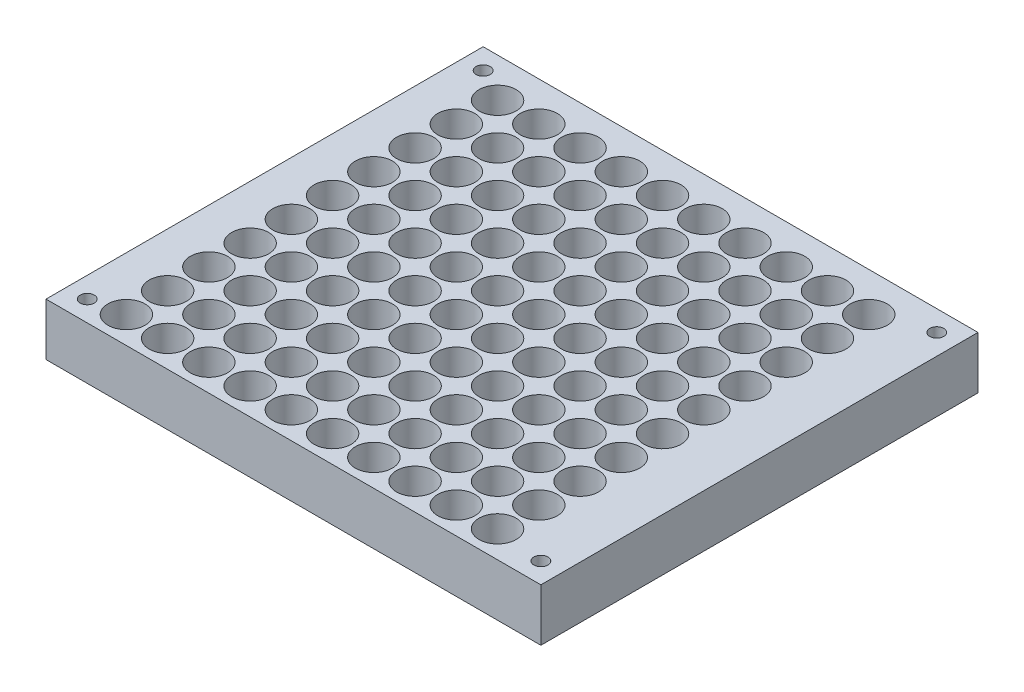
from build123d import *

# Parameters (mm, degrees)
SKETCH1_W           = 120
SKETCH1_H           = 106
SKETCH1_R           = 1.7
SKETCH1_R_2         = 4.5
BOSS_EXTRUDE1_DEPTH = 12.7


with BuildPart() as part:
    # Sketch1 → Boss-Extrude1 (new body)
    with BuildSketch(Plane(origin=(0, 0, 0), x_dir=(1, 0, 0), z_dir=(0, 1, 0))):
        with Locations((60, 53)):
            Rectangle(SKETCH1_W, SKETCH1_H)
        with Locations((5, 5)):
            Circle(SKETCH1_R, mode=Mode.SUBTRACT)
        with Locations((13, 6.5)):
            Circle(SKETCH1_R_2, mode=Mode.SUBTRACT)
        with Locations((23, 6.5)):
            Circle(SKETCH1_R_2, mode=Mode.SUBTRACT)
        with Locations((13, 16.5)):
            Circle(SKETCH1_R_2, mode=Mode.SUBTRACT)
        with Locations((13, 26.5)):
            Circle(SKETCH1_R_2, mode=Mode.SUBTRACT)
        with Locations((23, 16.5)):
            Circle(SKETCH1_R_2, mode=Mode.SUBTRACT)
        with Locations((23, 26.5)):
            Circle(SKETCH1_R_2, mode=Mode.SUBTRACT)
        with Locations((33, 6.5)):
            Circle(SKETCH1_R_2, mode=Mode.SUBTRACT)
        with Locations((43, 6.5)):
            Circle(SKETCH1_R_2, mode=Mode.SUBTRACT)
        with Locations((53, 6.5)):
            Circle(SKETCH1_R_2, mode=Mode.SUBTRACT)
        with Locations((33, 16.5)):
            Circle(SKETCH1_R_2, mode=Mode.SUBTRACT)
        with Locations((43, 16.5)):
            Circle(SKETCH1_R_2, mode=Mode.SUBTRACT)
        with Locations((33, 26.5)):
            Circle(SKETCH1_R_2, mode=Mode.SUBTRACT)
        with Locations((43, 26.5)):
            Circle(SKETCH1_R_2, mode=Mode.SUBTRACT)
        with Locations((53, 16.5)):
            Circle(SKETCH1_R_2, mode=Mode.SUBTRACT)
        with Locations((53, 26.5)):
            Circle(SKETCH1_R_2, mode=Mode.SUBTRACT)
        with Locations((13, 36.5)):
            Circle(SKETCH1_R_2, mode=Mode.SUBTRACT)
        with Locations((23, 36.5)):
            Circle(SKETCH1_R_2, mode=Mode.SUBTRACT)
        with Locations((13, 46.5)):
            Circle(SKETCH1_R_2, mode=Mode.SUBTRACT)
        with Locations((23, 46.5)):
            Circle(SKETCH1_R_2, mode=Mode.SUBTRACT)
        with Locations((33, 36.5)):
            Circle(SKETCH1_R_2, mode=Mode.SUBTRACT)
        with Locations((43, 36.5)):
            Circle(SKETCH1_R_2, mode=Mode.SUBTRACT)
        with Locations((53, 36.5)):
            Circle(SKETCH1_R_2, mode=Mode.SUBTRACT)
        with Locations((33, 46.5)):
            Circle(SKETCH1_R_2, mode=Mode.SUBTRACT)
        with Locations((43, 46.5)):
            Circle(SKETCH1_R_2, mode=Mode.SUBTRACT)
        with Locations((53, 46.5)):
            Circle(SKETCH1_R_2, mode=Mode.SUBTRACT)
        with Locations((63, 6.5)):
            Circle(SKETCH1_R_2, mode=Mode.SUBTRACT)
        with Locations((73, 6.5)):
            Circle(SKETCH1_R_2, mode=Mode.SUBTRACT)
        with Locations((83, 6.5)):
            Circle(SKETCH1_R_2, mode=Mode.SUBTRACT)
        with Locations((63, 16.5)):
            Circle(SKETCH1_R_2, mode=Mode.SUBTRACT)
        with Locations((73, 16.5)):
            Circle(SKETCH1_R_2, mode=Mode.SUBTRACT)
        with Locations((63, 26.5)):
            Circle(SKETCH1_R_2, mode=Mode.SUBTRACT)
        with Locations((73, 26.5)):
            Circle(SKETCH1_R_2, mode=Mode.SUBTRACT)
        with Locations((83, 16.5)):
            Circle(SKETCH1_R_2, mode=Mode.SUBTRACT)
        with Locations((83, 26.5)):
            Circle(SKETCH1_R_2, mode=Mode.SUBTRACT)
        with Locations((93, 6.5)):
            Circle(SKETCH1_R_2, mode=Mode.SUBTRACT)
        with Locations((103, 6.5)):
            Circle(SKETCH1_R_2, mode=Mode.SUBTRACT)
        with Locations((115, 5)):
            Circle(SKETCH1_R, mode=Mode.SUBTRACT)
        with Locations((93, 16.5)):
            Circle(SKETCH1_R_2, mode=Mode.SUBTRACT)
        with Locations((103, 16.5)):
            Circle(SKETCH1_R_2, mode=Mode.SUBTRACT)
        with Locations((93, 26.5)):
            Circle(SKETCH1_R_2, mode=Mode.SUBTRACT)
        with Locations((103, 26.5)):
            Circle(SKETCH1_R_2, mode=Mode.SUBTRACT)
        with Locations((63, 36.5)):
            Circle(SKETCH1_R_2, mode=Mode.SUBTRACT)
        with Locations((73, 36.5)):
            Circle(SKETCH1_R_2, mode=Mode.SUBTRACT)
        with Locations((83, 36.5)):
            Circle(SKETCH1_R_2, mode=Mode.SUBTRACT)
        with Locations((63, 46.5)):
            Circle(SKETCH1_R_2, mode=Mode.SUBTRACT)
        with Locations((73, 46.5)):
            Circle(SKETCH1_R_2, mode=Mode.SUBTRACT)
        with Locations((83, 46.5)):
            Circle(SKETCH1_R_2, mode=Mode.SUBTRACT)
        with Locations((93, 36.5)):
            Circle(SKETCH1_R_2, mode=Mode.SUBTRACT)
        with Locations((103, 36.5)):
            Circle(SKETCH1_R_2, mode=Mode.SUBTRACT)
        with Locations((93, 46.5)):
            Circle(SKETCH1_R_2, mode=Mode.SUBTRACT)
        with Locations((103, 46.5)):
            Circle(SKETCH1_R_2, mode=Mode.SUBTRACT)
        with Locations((13, 56.5)):
            Circle(SKETCH1_R_2, mode=Mode.SUBTRACT)
        with Locations((23, 56.5)):
            Circle(SKETCH1_R_2, mode=Mode.SUBTRACT)
        with Locations((13, 66.5)):
            Circle(SKETCH1_R_2, mode=Mode.SUBTRACT)
        with Locations((13, 76.5)):
            Circle(SKETCH1_R_2, mode=Mode.SUBTRACT)
        with Locations((23, 66.5)):
            Circle(SKETCH1_R_2, mode=Mode.SUBTRACT)
        with Locations((23, 76.5)):
            Circle(SKETCH1_R_2, mode=Mode.SUBTRACT)
        with Locations((33, 56.5)):
            Circle(SKETCH1_R_2, mode=Mode.SUBTRACT)
        with Locations((43, 56.5)):
            Circle(SKETCH1_R_2, mode=Mode.SUBTRACT)
        with Locations((53, 56.5)):
            Circle(SKETCH1_R_2, mode=Mode.SUBTRACT)
        with Locations((33, 66.5)):
            Circle(SKETCH1_R_2, mode=Mode.SUBTRACT)
        with Locations((43, 66.5)):
            Circle(SKETCH1_R_2, mode=Mode.SUBTRACT)
        with Locations((33, 76.5)):
            Circle(SKETCH1_R_2, mode=Mode.SUBTRACT)
        with Locations((43, 76.5)):
            Circle(SKETCH1_R_2, mode=Mode.SUBTRACT)
        with Locations((53, 66.5)):
            Circle(SKETCH1_R_2, mode=Mode.SUBTRACT)
        with Locations((53, 76.5)):
            Circle(SKETCH1_R_2, mode=Mode.SUBTRACT)
        with Locations((13, 86.5)):
            Circle(SKETCH1_R_2, mode=Mode.SUBTRACT)
        with Locations((23, 86.5)):
            Circle(SKETCH1_R_2, mode=Mode.SUBTRACT)
        with Locations((13, 96.5)):
            Circle(SKETCH1_R_2, mode=Mode.SUBTRACT)
        with Locations((5, 101)):
            Circle(SKETCH1_R, mode=Mode.SUBTRACT)
        with Locations((23, 96.5)):
            Circle(SKETCH1_R_2, mode=Mode.SUBTRACT)
        with Locations((33, 86.5)):
            Circle(SKETCH1_R_2, mode=Mode.SUBTRACT)
        with Locations((43, 86.5)):
            Circle(SKETCH1_R_2, mode=Mode.SUBTRACT)
        with Locations((53, 86.5)):
            Circle(SKETCH1_R_2, mode=Mode.SUBTRACT)
        with Locations((33, 96.5)):
            Circle(SKETCH1_R_2, mode=Mode.SUBTRACT)
        with Locations((43, 96.5)):
            Circle(SKETCH1_R_2, mode=Mode.SUBTRACT)
        with Locations((53, 96.5)):
            Circle(SKETCH1_R_2, mode=Mode.SUBTRACT)
        with Locations((63, 56.5)):
            Circle(SKETCH1_R_2, mode=Mode.SUBTRACT)
        with Locations((73, 56.5)):
            Circle(SKETCH1_R_2, mode=Mode.SUBTRACT)
        with Locations((83, 56.5)):
            Circle(SKETCH1_R_2, mode=Mode.SUBTRACT)
        with Locations((63, 66.5)):
            Circle(SKETCH1_R_2, mode=Mode.SUBTRACT)
        with Locations((73, 66.5)):
            Circle(SKETCH1_R_2, mode=Mode.SUBTRACT)
        with Locations((63, 76.5)):
            Circle(SKETCH1_R_2, mode=Mode.SUBTRACT)
        with Locations((73, 76.5)):
            Circle(SKETCH1_R_2, mode=Mode.SUBTRACT)
        with Locations((83, 66.5)):
            Circle(SKETCH1_R_2, mode=Mode.SUBTRACT)
        with Locations((83, 76.5)):
            Circle(SKETCH1_R_2, mode=Mode.SUBTRACT)
        with Locations((93, 56.5)):
            Circle(SKETCH1_R_2, mode=Mode.SUBTRACT)
        with Locations((103, 56.5)):
            Circle(SKETCH1_R_2, mode=Mode.SUBTRACT)
        with Locations((93, 66.5)):
            Circle(SKETCH1_R_2, mode=Mode.SUBTRACT)
        with Locations((103, 66.5)):
            Circle(SKETCH1_R_2, mode=Mode.SUBTRACT)
        with Locations((93, 76.5)):
            Circle(SKETCH1_R_2, mode=Mode.SUBTRACT)
        with Locations((103, 76.5)):
            Circle(SKETCH1_R_2, mode=Mode.SUBTRACT)
        with Locations((63, 86.5)):
            Circle(SKETCH1_R_2, mode=Mode.SUBTRACT)
        with Locations((73, 86.5)):
            Circle(SKETCH1_R_2, mode=Mode.SUBTRACT)
        with Locations((83, 86.5)):
            Circle(SKETCH1_R_2, mode=Mode.SUBTRACT)
        with Locations((63, 96.5)):
            Circle(SKETCH1_R_2, mode=Mode.SUBTRACT)
        with Locations((73, 96.5)):
            Circle(SKETCH1_R_2, mode=Mode.SUBTRACT)
        with Locations((83, 96.5)):
            Circle(SKETCH1_R_2, mode=Mode.SUBTRACT)
        with Locations((93, 86.5)):
            Circle(SKETCH1_R_2, mode=Mode.SUBTRACT)
        with Locations((103, 86.5)):
            Circle(SKETCH1_R_2, mode=Mode.SUBTRACT)
        with Locations((93, 96.5)):
            Circle(SKETCH1_R_2, mode=Mode.SUBTRACT)
        with Locations((103, 96.5)):
            Circle(SKETCH1_R_2, mode=Mode.SUBTRACT)
        with Locations((115, 101)):
            Circle(SKETCH1_R, mode=Mode.SUBTRACT)
    extrude(amount=BOSS_EXTRUDE1_DEPTH)


solid = part.part
